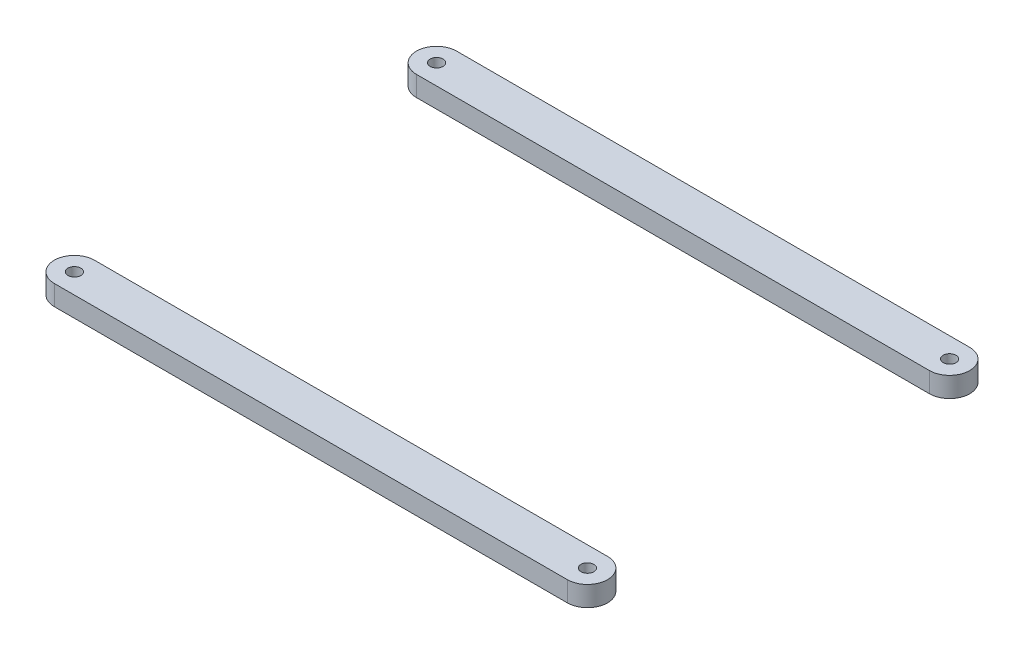
from build123d import *

# Parameters (mm, degrees)
SKETCH1_R             = 3.2
BOSS_EXTRUDE4_DEPTH   = 10
BOSS_EXTRUDE4_2_DEPTH = 10


with BuildPart() as part:
    # Sketch1 → Boss-Extrude4 (new body)
    with BuildSketch(Plane(origin=(0, 0, 0), x_dir=(1, 0, 0), z_dir=(0, 1, 0))):
        with BuildLine():
            Line((-255, 9.36315173), (0, 9.36315173))
            ThreePointArc((0, 9.36315173), (10, -0.63684827), (0, -10.63684827))
            Line((0, -10.63684827), (-255, -10.63684827))
            ThreePointArc((-255, -10.63684827), (-265, -0.63684827), (-255, 9.36315173))
        make_face()
        with Locations((0, -0.63684827)):
            Circle(SKETCH1_R, mode=Mode.SUBTRACT)
        with Locations((-255, -0.63684827)):
            Circle(SKETCH1_R, mode=Mode.SUBTRACT)
    extrude(amount=BOSS_EXTRUDE4_DEPTH)


with BuildPart() as body_2:
    # Sketch1 → Boss-Extrude4 2 (new body)
    with BuildSketch(Plane(origin=(0, 0, 0), x_dir=(1, 0, 0), z_dir=(0, 1, 0))):
        with BuildLine():
            Line((-255, 189.36315173), (0, 189.36315173))
            ThreePointArc((0, 189.36315173), (10, 179.36315173), (0, 169.36315173))
            Line((0, 169.36315173), (-255, 169.36315173))
            ThreePointArc((-255, 169.36315173), (-265, 179.36315173), (-255, 189.36315173))
        make_face()
        with Locations((-255, 179.36315173)):
            Circle(SKETCH1_R, mode=Mode.SUBTRACT)
        with Locations((0, 179.36315173)):
            Circle(SKETCH1_R, mode=Mode.SUBTRACT)
    extrude(amount=BOSS_EXTRUDE4_2_DEPTH)


solid = Compound([part.part, body_2.part])
